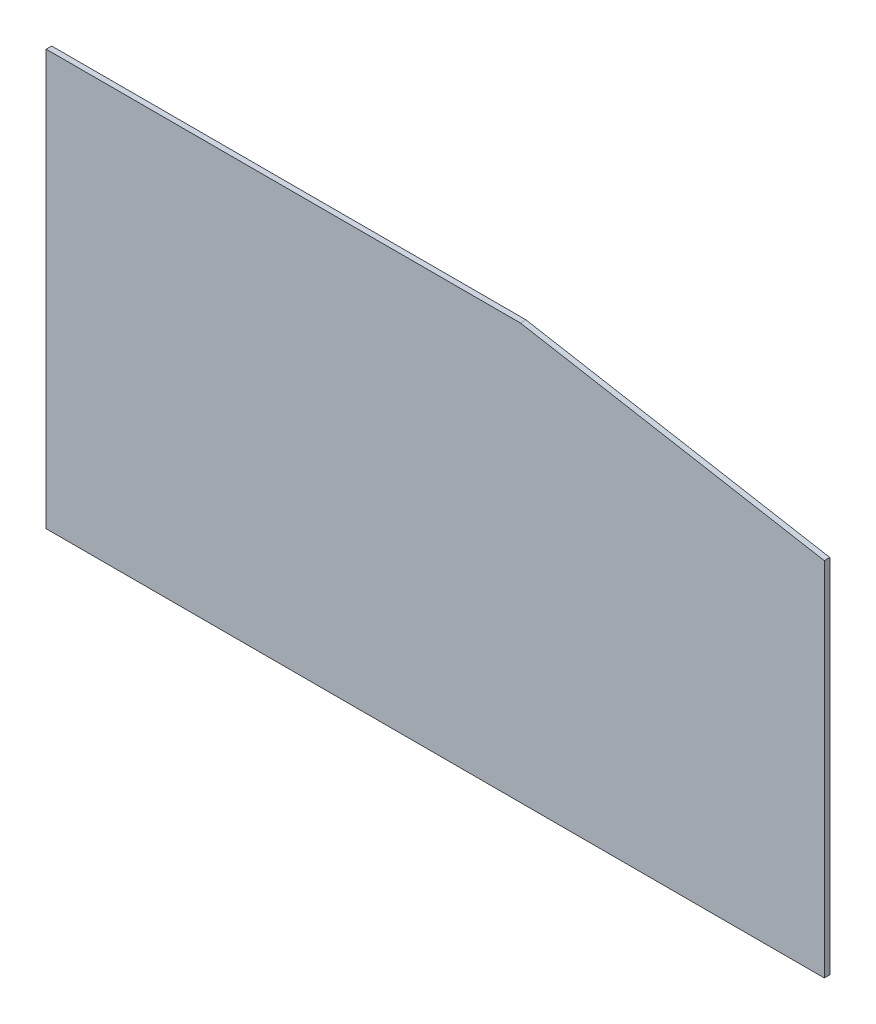
from build123d import *

# Parameters (mm, degrees)
TABAN_FLAN_1_DEPTH         = 12
KES_EKSTR_ZYON1_DEPTH      = 2662.181692407
KES_EKSTR_ZYON1_DEPTH_BACK = 2662.181692407
IZIM2_W                    = 2500
IZIM2_H                    = 10
KES_EKSTR_ZYON2_DEPTH      = 2662.181692407
KES_EKSTR_ZYON2_DEPTH_BACK = 2662.181692407


# Sheet-metal steps are written as plain solids
with BuildPart() as part:
    # Çizim1 → Taban-Flanş1 (new body)
    with BuildSketch(Plane.XY):
        Polygon((0, 0), (0, 795), (660, 912), (1840, 912), (2500, 795), (2500, 0), align=None)
    extrude(amount=-TABAN_FLAN_1_DEPTH)

    # Çizim2 → Kes-Ekstrüzyon1 (cut, two sides: drawn at the far end of the back side and taken through both)
    with BuildSketch(Plane.XY.offset(-KES_EKSTR_ZYON1_DEPTH_BACK)):
        with Locations((1250, 5)):
            Rectangle(IZIM2_W, IZIM2_H)
    extrude(amount=KES_EKSTR_ZYON1_DEPTH + KES_EKSTR_ZYON1_DEPTH_BACK, mode=Mode.SUBTRACT)

    # Çizim3 → Kes-Ekstrüzyon2 (cut, two sides: drawn at the far end of the back side and taken through both)
    with BuildSketch(Plane.XY.offset(-KES_EKSTR_ZYON2_DEPTH_BACK)):
        Polygon((810, 10), (810, 912), (-172.469977519, 1159.159604292), (-279.270596873, -118.492249454), (448.555846128, -150.136877411), align=None)
    extrude(amount=KES_EKSTR_ZYON2_DEPTH + KES_EKSTR_ZYON2_DEPTH_BACK, mode=Mode.SUBTRACT)


solid = part.part
